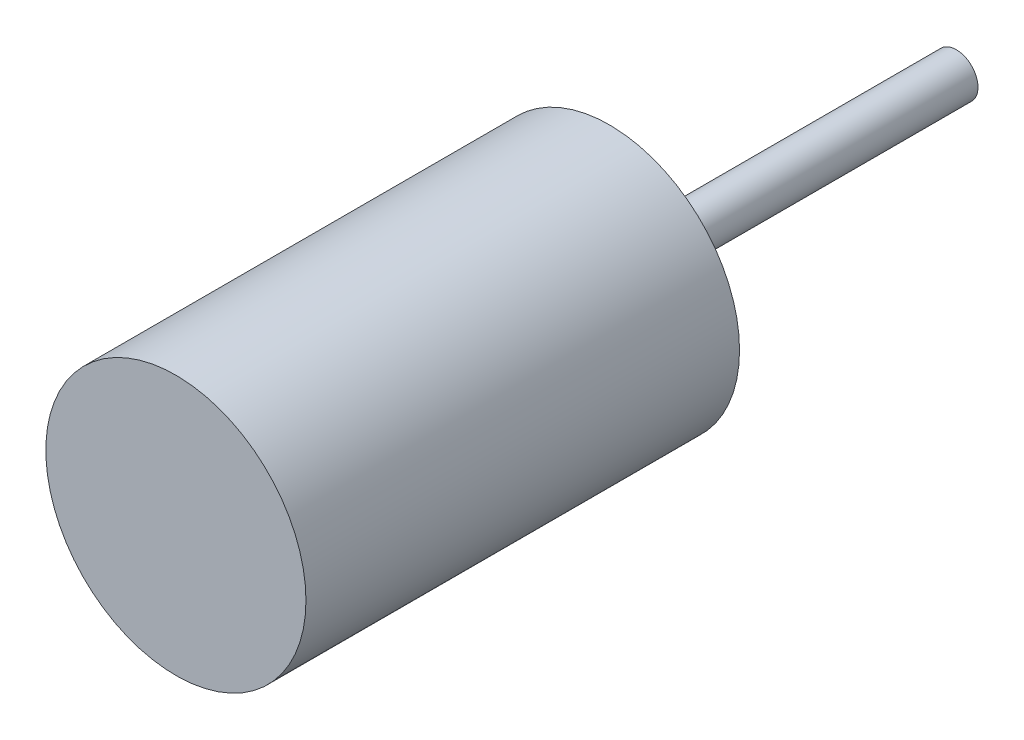
from build123d import *

# Parameters (mm, degrees)
SKETCH1_R           = 0.5
BOSS_EXTRUDE1_DEPTH = 8
SKETCH2_R           = 3
BOSS_EXTRUDE2_DEPTH = 10


with BuildPart() as part:
    # Sketch1 → Boss-Extrude1 (new body)
    with BuildSketch(Plane.XY):
        Circle(SKETCH1_R)
    extrude(amount=BOSS_EXTRUDE1_DEPTH)

    # Sketch2 → Boss-Extrude2 (add)
    with BuildSketch(Plane.XY.offset(8)):
        Circle(SKETCH2_R)
    extrude(amount=BOSS_EXTRUDE2_DEPTH)


solid = part.part
